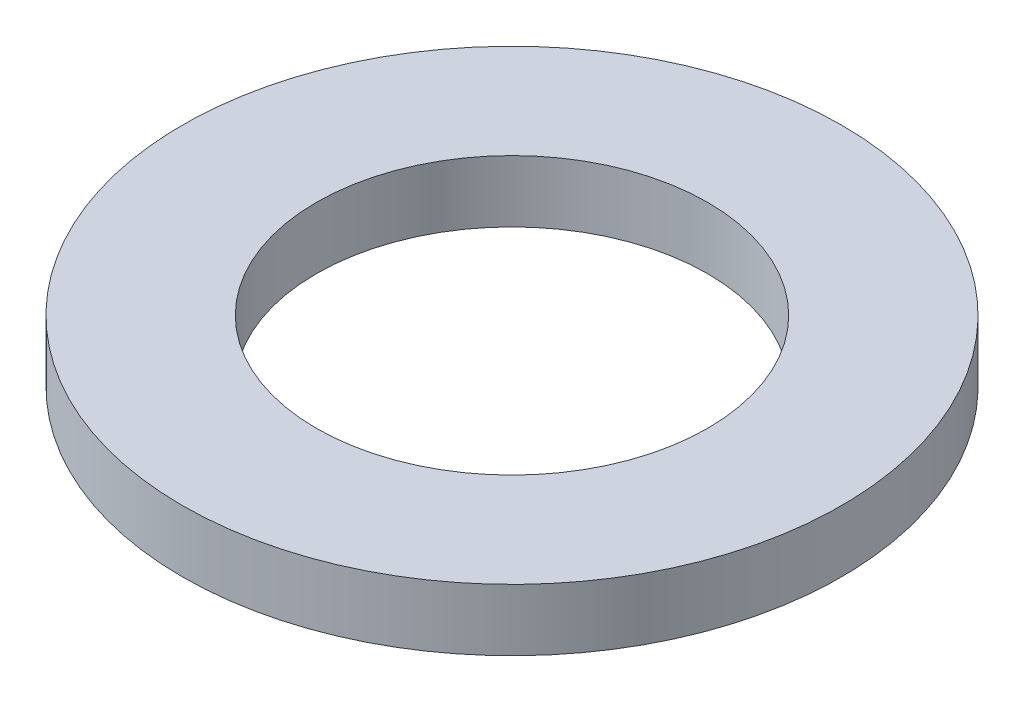
from build123d import *

# Parameters (mm, degrees)
SKETCH1_R           = 80
BOSS_EXTRUDE1_DEPTH = 15
SKETCH2_R           = 47.5
CUT_EXTRUDE1_DEPTH  = 115.127122105


with BuildPart() as part:
    # Sketch1 → Boss-Extrude1 (new body)
    with BuildSketch(Plane(origin=(0, 0, 0), x_dir=(1, 0, 0), z_dir=(0, 1, 0))):
        Circle(SKETCH1_R)
    extrude(amount=BOSS_EXTRUDE1_DEPTH)

    # Sketch2 → Cut-Extrude1 (cut, through all)
    with BuildSketch(Plane(origin=(0, 0, 0), x_dir=(1, 0, 0), z_dir=(0, 1, 0))):
        Circle(SKETCH2_R)
    extrude(amount=CUT_EXTRUDE1_DEPTH, mode=Mode.SUBTRACT)


solid = part.part
